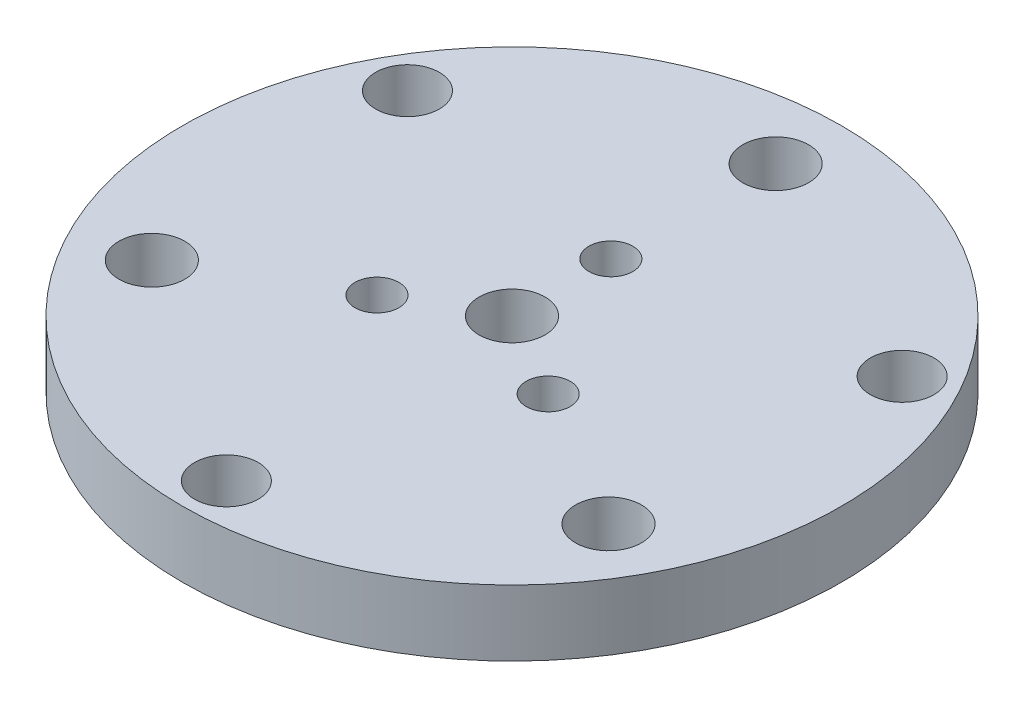
from build123d import *

# Parameters (mm, degrees)
SKETCH_1_R      = 15
SKETCH_1_R_2    = 1.45
SKETCH_1_R_3    = 1.5
SKETCH_1_R_4    = 1
EXTRUDE_1_DEPTH = 3


with BuildPart() as part:
    # 草图1 → 凸台-拉伸1 (new body)
    with BuildSketch(Plane(origin=(0, 0, 0), x_dir=(1, 0, 0), z_dir=(0, 1, 0))):
        Circle(SKETCH_1_R)
        with Locations((0, -13)):
            Circle(SKETCH_1_R_2, mode=Mode.SUBTRACT)
        with Locations((-11.258330249, 6.5)):
            Circle(SKETCH_1_R_2, mode=Mode.SUBTRACT)
        with Locations((11.258330249, 6.5)):
            Circle(SKETCH_1_R_2, mode=Mode.SUBTRACT)
        with Locations((0, 12)):
            Circle(SKETCH_1_R_3, mode=Mode.SUBTRACT)
        with Locations((10.392304845, -6)):
            Circle(SKETCH_1_R_3, mode=Mode.SUBTRACT)
        with Locations((-10.392304845, -6)):
            Circle(SKETCH_1_R_3, mode=Mode.SUBTRACT)
        with Locations((0, 4.5)):
            Circle(SKETCH_1_R_4, mode=Mode.SUBTRACT)
        with Locations((3.897114317, -2.25)):
            Circle(SKETCH_1_R_4, mode=Mode.SUBTRACT)
        with Locations((-3.897114317, -2.25)):
            Circle(SKETCH_1_R_4, mode=Mode.SUBTRACT)
        Circle(SKETCH_1_R_3, mode=Mode.SUBTRACT)
    extrude(amount=EXTRUDE_1_DEPTH)


solid = part.part
